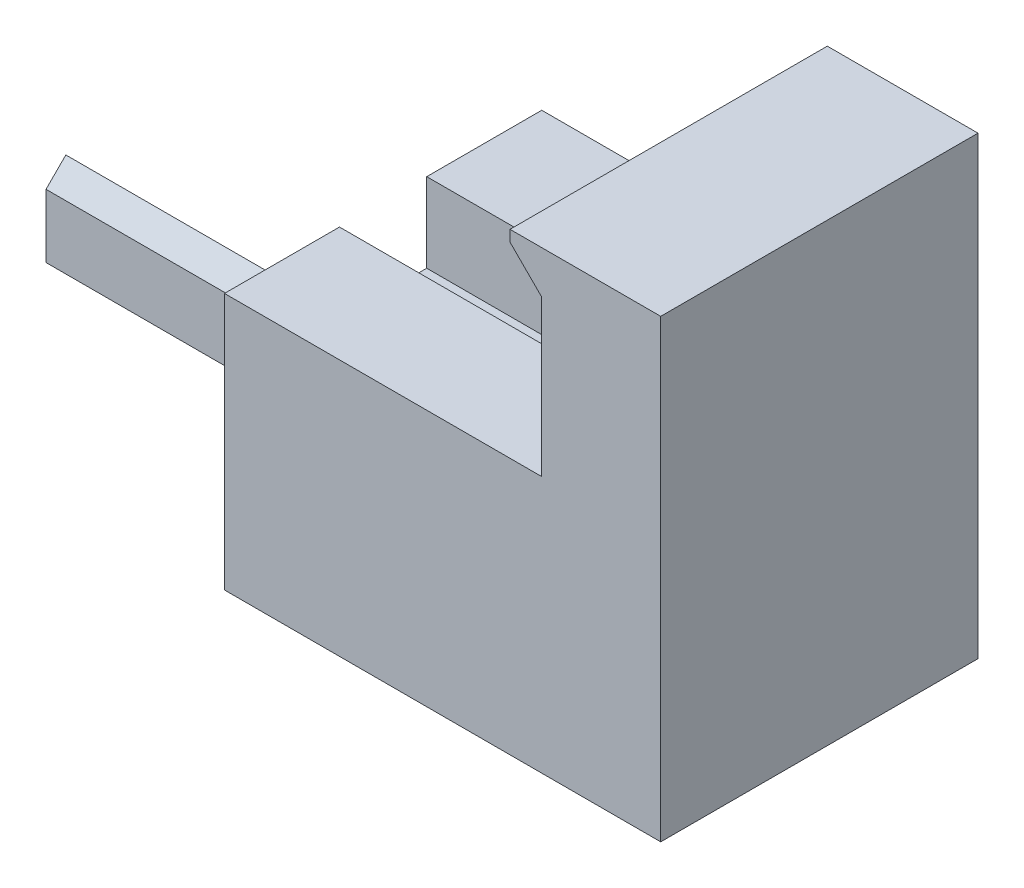
from build123d import *

# Parameters (mm, degrees)
ESQUISSE1_W             = 27.5
ESQUISSE1_H             = 20
BOSS_EXTRU_1_DEPTH      = 16.19
ESQUISSE2_W             = 7.5
ESQUISSE2_H             = 20
BOSS_EXTRU_2_DEPTH      = 12.5
BOSS_EXTRU_4_DEPTH      = 20
ESQUISSE5_W             = 15
ESQUISSE5_H             = 5.5
ENL_V_MAT_EXTRU_1_DEPTH = 5
ESQUISSE11_R            = 1
BOSS_EXTRU_5_DEPTH      = 5.5
ESQUISSE12_W            = 20
ESQUISSE12_H            = 2.7
BOSS_EXTRU_6_DEPTH      = 2
CHANFREIN1_SIZE         = 2


with BuildPart() as part:
    # Esquisse1 → Boss.-Extru.1 (new body)
    with BuildSketch(Plane(origin=(0, 0, 0), x_dir=(1, 0, 0), z_dir=(0, 1, 0))):
        with Locations((13.75, 10)):
            Rectangle(ESQUISSE1_W, ESQUISSE1_H)
    extrude(amount=BOSS_EXTRU_1_DEPTH)

    # Esquisse2 → Boss.-Extru.2 (add)
    with BuildSketch(Plane(origin=(0, 16.19, 0), x_dir=(1, 0, 0), z_dir=(0, 1, 0))):
        with Locations((23.75, 10)):
            Rectangle(ESQUISSE2_W, ESQUISSE2_H)
    extrude(amount=BOSS_EXTRU_2_DEPTH)

    # Esquisse4 → Boss.-Extru.4 (add)
    with BuildSketch(Plane.ZY):
        Polygon((-8.75, 7.5), (-8.75, 3.5), (-10, 2.25), (-11.25, 3.5), (-11.25, 7.5), (-10, 8.75), align=None)
    extrude(amount=BOSS_EXTRU_4_DEPTH)

    # Esquisse5 → Enlèv. mat.-Extru.1 (cut)
    with BuildSketch(Plane(origin=(0, 16.19, 0), x_dir=(1, 0, 0), z_dir=(0, 1, 0))):
        with Locations((7.5, 10)):
            Rectangle(ESQUISSE5_W, ESQUISSE5_H)
    extrude(amount=-ENL_V_MAT_EXTRU_1_DEPTH, mode=Mode.SUBTRACT)

    # Esquisse11 → Boss.-Extru.5 (add)
    with BuildSketch(Plane.XY.offset(-12.75)):
        with Locations(Location((11.77506405, 13.69, 0), (0, 0, 180))):
            Circle(ESQUISSE11_R)
    extrude(amount=BOSS_EXTRU_5_DEPTH)

    # Esquisse12 → Boss.-Extru.6 (add)
    with BuildSketch(Plane.ZY.offset(-20)):
        with Locations((-10, 27.34)):
            Rectangle(ESQUISSE12_W, ESQUISSE12_H)
    extrude(amount=BOSS_EXTRU_6_DEPTH)

    # Chanfrein1
    chanfrein1_edges = [part.edges().sort_by_distance(p)[0] for p in [
        (18, 25.99, -10),
    ]]
    chamfer(chanfrein1_edges, length=CHANFREIN1_SIZE - 0.0001)  # a hair under: the kernel refuses the full size


solid = part.part
